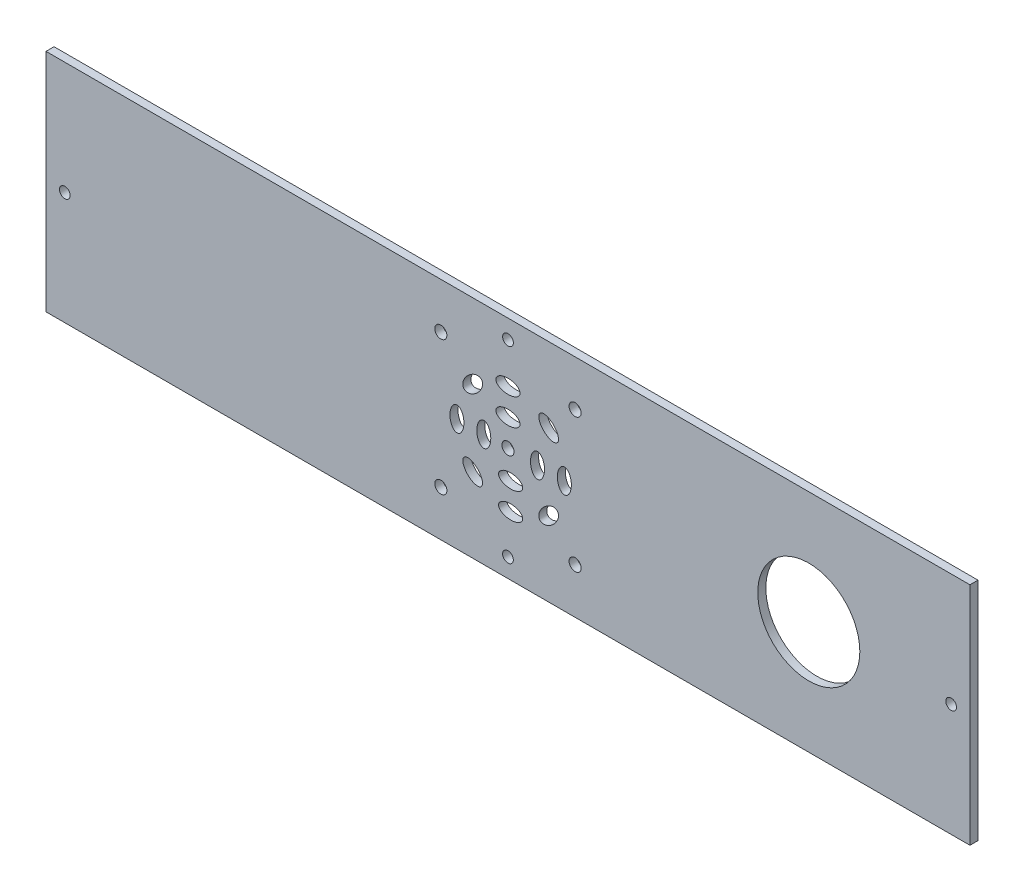
from build123d import *

# Parameters (mm, degrees)
SCHIZZO1_W                   = 344
SCHIZZO1_H                   = 84
SCHIZZO1_R                   = 2
SCHIZZO1_R_2                 = 2.25
SCHIZZO1_R_3                 = 19
SCHIZZO1_RX                  = 4.5
SCHIZZO1_RY                  = 2.6
ESTRUSIONE_ESTRUSIONE1_DEPTH = 3


with BuildPart() as part:
    # Schizzo1 → Estrusione-Estrusione1 (new body)
    with BuildSketch(Plane.XY):
        with Locations((172, 42)):
            Rectangle(SCHIZZO1_W, SCHIZZO1_H)
        with Locations((7, 42)):
            Circle(SCHIZZO1_R, mode=Mode.SUBTRACT)
        with Locations((172, 77)):
            Circle(SCHIZZO1_R, mode=Mode.SUBTRACT)
        with Locations((172, 7)):
            Circle(SCHIZZO1_R, mode=Mode.SUBTRACT)
        with Locations((337, 42)):
            Circle(SCHIZZO1_R, mode=Mode.SUBTRACT)
        with Locations((172, 42)):
            Circle(SCHIZZO1_R_2, mode=Mode.SUBTRACT)
        with Locations((147, 67)):
            Circle(SCHIZZO1_R_2, mode=Mode.SUBTRACT)
        with Locations((147, 17)):
            Circle(SCHIZZO1_R_2, mode=Mode.SUBTRACT)
        with Locations((197, 17)):
            Circle(SCHIZZO1_R_2, mode=Mode.SUBTRACT)
        with Locations((197, 67)):
            Circle(SCHIZZO1_R_2, mode=Mode.SUBTRACT)
        with Locations((284, 42)):
            Circle(SCHIZZO1_R_3, mode=Mode.SUBTRACT)
        with Locations(Location((172, 52), (0, 0, -180))):
            Ellipse(SCHIZZO1_RX, SCHIZZO1_RY, mode=Mode.SUBTRACT)
        with Locations(Location((183, 42), (0, 0, -90))):
            Ellipse(SCHIZZO1_RX, SCHIZZO1_RY, mode=Mode.SUBTRACT)
        with Locations(Location((173, 32), (0, 0, 180))):
            Ellipse(SCHIZZO1_RX, SCHIZZO1_RY, mode=Mode.SUBTRACT)
        with Locations(Location((163, 42), (0, 0, 90))):
            Ellipse(SCHIZZO1_RX, SCHIZZO1_RY, mode=Mode.SUBTRACT)
        with Locations(Location((172, 62), (0, 0, 180))):
            Ellipse(SCHIZZO1_RX, SCHIZZO1_RY, mode=Mode.SUBTRACT)
        with Locations(Location((187.142135624, 56.142135624), (0, 0, -45))):
            Ellipse(SCHIZZO1_RX, SCHIZZO1_RY, mode=Mode.SUBTRACT)
        with Locations(Location((193, 42), (0, 0, -90))):
            Ellipse(SCHIZZO1_RX, SCHIZZO1_RY, mode=Mode.SUBTRACT)
        with Locations(Location((187.142135624, 27.857864376), (0, 0, -135))):
            Ellipse(SCHIZZO1_RX, SCHIZZO1_RY, mode=Mode.SUBTRACT)
        with Locations(Location((173, 22), (0, 0, 180))):
            Ellipse(SCHIZZO1_RX, SCHIZZO1_RY, mode=Mode.SUBTRACT)
        with Locations(Location((158.857864376, 27.857864376), (0, 0, 135))):
            Ellipse(SCHIZZO1_RX, SCHIZZO1_RY, mode=Mode.SUBTRACT)
        with Locations(Location((153, 42), (0, 0, 90))):
            Ellipse(SCHIZZO1_RX, SCHIZZO1_RY, mode=Mode.SUBTRACT)
        with Locations(Location((158.857864376, 56.142135624), (0, 0, 45))):
            Ellipse(SCHIZZO1_RX, SCHIZZO1_RY, mode=Mode.SUBTRACT)
    extrude(amount=ESTRUSIONE_ESTRUSIONE1_DEPTH)


solid = part.part
